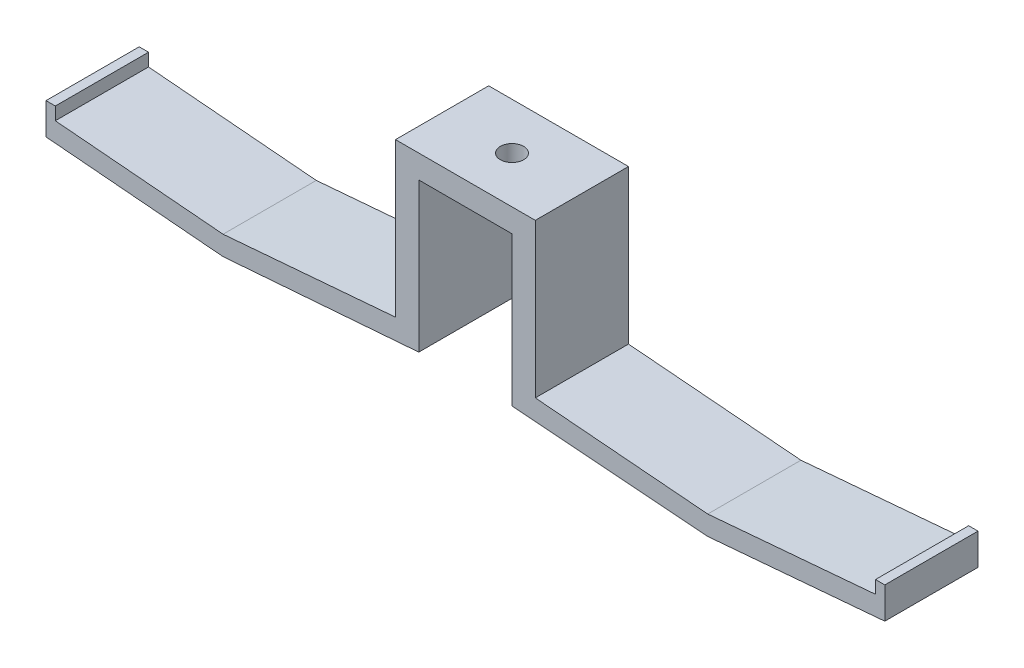
from build123d import *

# Parameters (mm, degrees)
BOSS_EXTRUDE1_DEPTH = 25.4
CUT_EXTRUDE1_REACH  = 129.762
SKETCH3_R           = 3.175


with BuildPart() as part:
    # Sketch2 → Boss-Extrude1 (new body)
    with BuildSketch(Plane.XY):
        Polygon((12.7, 0), (12.7, -40.64), (66.04, -44.773379719), (114.3, -40.64), (114.3, -32.073379719), (111.76, -32.073379719), (111.76, -35.56), (66.04, -39.475833418), (19.05, -35.56), (19.05, 6.35), (-19.05, 6.35), (-19.05, -35.56), (-66.04, -39.475833418), (-111.76, -35.56), (-111.76, -32.073379719), (-114.3, -32.073379719), (-114.3, -40.64), (-66.04, -44.773379719), (-12.7, -40.64), (-12.7, 0), align=None)
    extrude(amount=BOSS_EXTRUDE1_DEPTH)

    # Sketch3 → Cut-Extrude1 (cut, up to next)
    with BuildSketch(Plane(origin=(0, 6.35, 0), x_dir=(1, 0, 0), z_dir=(0, 1, 0)), mode=Mode.PRIVATE) as cut_extrude1_sk1:
        with Locations((0, -12.7)):
            Circle(SKETCH3_R)
    cut_extrude1_tool1 = extrude(cut_extrude1_sk1.sketch, amount=-CUT_EXTRUDE1_REACH, mode=Mode.PRIVATE) & part.part
    add(cut_extrude1_tool1.solids().sort_by_distance((0, 6.35, 12.7))[0], mode=Mode.SUBTRACT)


solid = part.part
